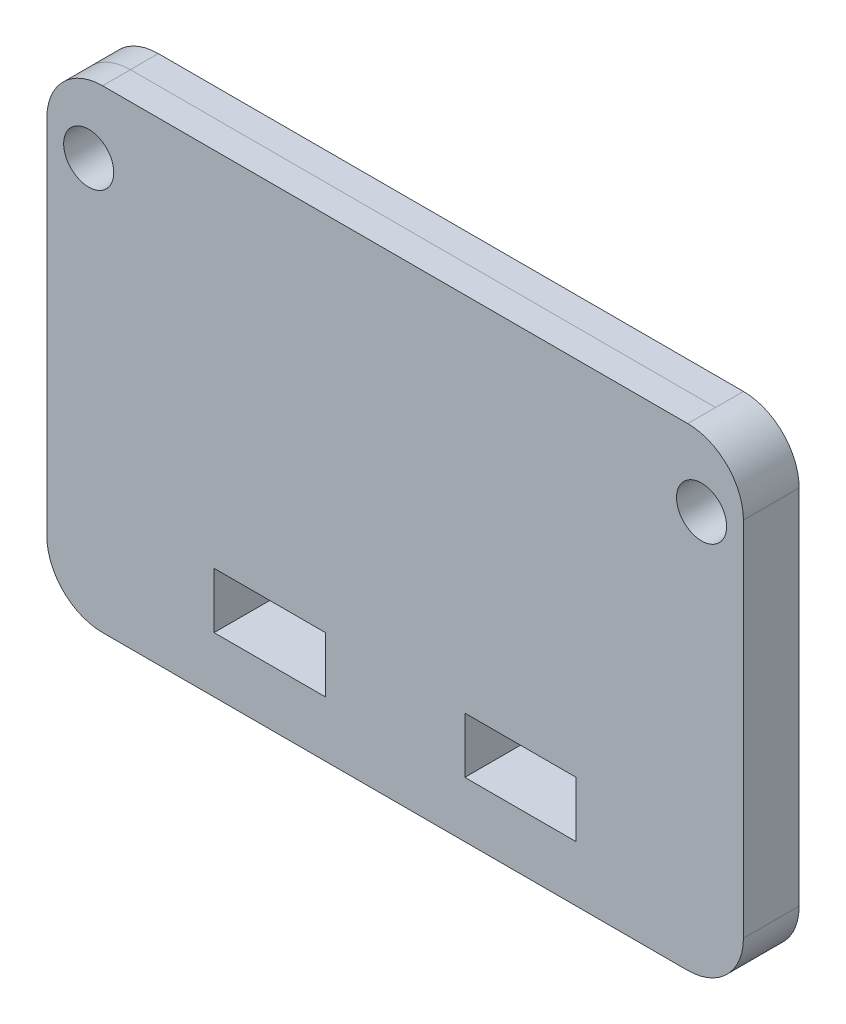
from build123d import *

# Parameters (mm, degrees)
SKETCH1_R                      = 11.422
BOSS_EXTRUDE1_DEPTH            = 25.4
SKETCH2_W                      = 50.8
SKETCH2_H                      = 25.4
FOAM_INSERT_CUT_THROUGHS_DEPTH = 25.4


with BuildPart() as part:
    # Sketch1 → Boss-Extrude1 (new body)
    with BuildSketch(Plane.XY):
        with BuildLine():
            Line((-133.373251541, -107.95), (133.373251541, -107.95))
            ThreePointArc((133.373251541, -107.95), (151.333763783, -100.510512242), (158.773251541, -82.55))
            Line((158.773251541, -82.55), (158.773251541, 82.55))
            ThreePointArc((158.773251541, 82.55), (151.333763783, 100.510512242), (133.373251541, 107.95))
            Line((133.373251541, 107.95), (-133.373251541, 107.95))
            ThreePointArc((-133.373251541, 107.95), (-151.333763783, 100.510512242), (-158.773251541, 82.55))
            Line((-158.773251541, 82.55), (-158.773251541, -82.55))
            ThreePointArc((-158.773251541, -82.55), (-151.333763783, -100.510512242), (-133.373251541, -107.95))
        make_face()
        with Locations((-139.7, 76.2)):
            Circle(SKETCH1_R, mode=Mode.SUBTRACT)
        with Locations((139.7, 76.2)):
            Circle(SKETCH1_R, mode=Mode.SUBTRACT)
    extrude(amount=BOSS_EXTRUDE1_DEPTH)

    # Sketch2 → Foam Insert Cut-Throughs (cut)
    with BuildSketch(Plane(origin=(0, 0, 0), x_dir=(-1, 0, 0), z_dir=(0, 0, -1))):
        with Locations((-57.15, -69.85)):
            Rectangle(SKETCH2_W, SKETCH2_H)
        with Locations((57.15, -69.85)):
            Rectangle(SKETCH2_W, SKETCH2_H)
    extrude(amount=-FOAM_INSERT_CUT_THROUGHS_DEPTH, mode=Mode.SUBTRACT)


solid = part.part
